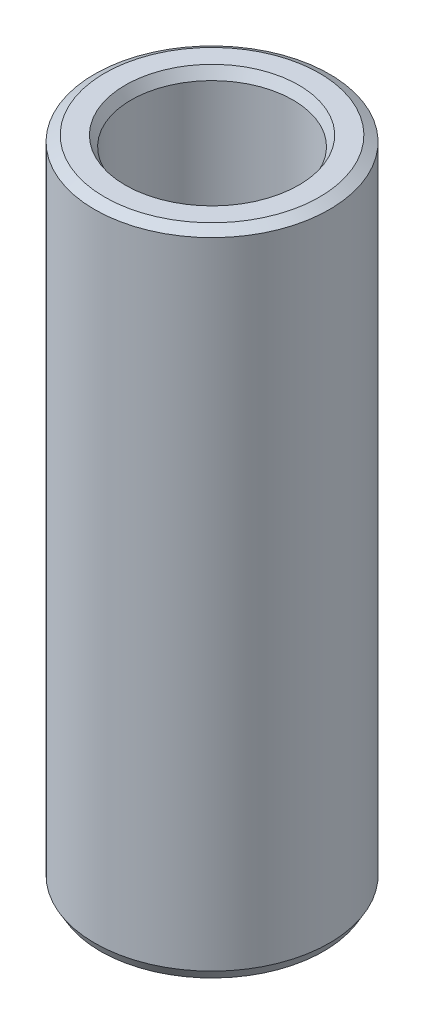
from build123d import *
from OCP.BRepFilletAPI import BRepFilletAPI_MakeChamfer

# Parameters (mm, degrees)
SKETCH1_R           = 57.5
BOSS_EXTRUDE1_DEPTH = 318.869293219
SKETCH2_R           = 39.650099011
CUT_EXTRUDE1_DEPTH  = 330.074651345
CHAMFER1_SIZE       = 2.833281621
CHAMFER1_SIZE2      = 4.90738772


with BuildPart() as part:
    # Sketch1 → Boss-Extrude1 (new body)
    with BuildSketch(Plane(origin=(0, 0, 0), x_dir=(1, 0, 0), z_dir=(0, 1, 0))):
        Circle(SKETCH1_R)
    extrude(amount=BOSS_EXTRUDE1_DEPTH)

    # Sketch2 → Cut-Extrude1 (cut, through all)
    with BuildSketch(Plane(origin=(0, 0, 0), x_dir=(1, 0, 0), z_dir=(0, 1, 0))):
        Circle(SKETCH2_R)
    extrude(amount=CUT_EXTRUDE1_DEPTH, mode=Mode.SUBTRACT)

    # Chamfer1: one chamfer whose edges measure the first distance from different faces: ONE call of the kernel's chamfer builder (chamfer() names one face for all edges)
    chamfer1_edges_1 = [part.edges().sort_by_distance(p)[0] for p in [
        (-39.650099011, 318.869293219, 0),
    ]]
    chamfer1_side_1 = [part.faces().sort_by_distance(p)[0] for p in [
        (-55.873654403, 318.869293219, 0),
    ]]
    chamfer1_edges_2 = [part.edges().sort_by_distance(p)[0] for p in [
        (-39.650099011, 0, 0),
    ]]
    chamfer1_side_2 = [part.faces().sort_by_distance(p)[0] for p in [
        (-39.650099011, 159.434646609, 0),
    ]]
    chamfer1_edges_3 = [part.edges().sort_by_distance(p)[0] for p in [
        (-57.5, 0, 0),
    ]]
    chamfer1_side_3 = [part.faces().sort_by_distance(p)[0] for p in [
        (-55.873654403, 0, 0),
    ]]
    chamfer1_edges_4 = [part.edges().sort_by_distance(p)[0] for p in [
        (-57.5, 318.869293219, 0),
    ]]
    chamfer1_side_4 = [part.faces().sort_by_distance(p)[0] for p in [
        (-57.5, 159.434646609, 0),
    ]]
    chamfer1 = BRepFilletAPI_MakeChamfer(part.part.solid().wrapped)
    for e in chamfer1_edges_1:
        chamfer1.Add(CHAMFER1_SIZE, CHAMFER1_SIZE2, e.wrapped, chamfer1_side_1[0].wrapped)  # the first distance lies on this face
    for e in chamfer1_edges_2:
        chamfer1.Add(CHAMFER1_SIZE, CHAMFER1_SIZE2, e.wrapped, chamfer1_side_2[0].wrapped)  # the first distance lies on this face
    for e in chamfer1_edges_3:
        chamfer1.Add(CHAMFER1_SIZE, CHAMFER1_SIZE2, e.wrapped, chamfer1_side_3[0].wrapped)  # the first distance lies on this face
    for e in chamfer1_edges_4:
        chamfer1.Add(CHAMFER1_SIZE, CHAMFER1_SIZE2, e.wrapped, chamfer1_side_4[0].wrapped)  # the first distance lies on this face
    add(Compound.cast(chamfer1.Shape()), mode=Mode.REPLACE)


solid = part.part
